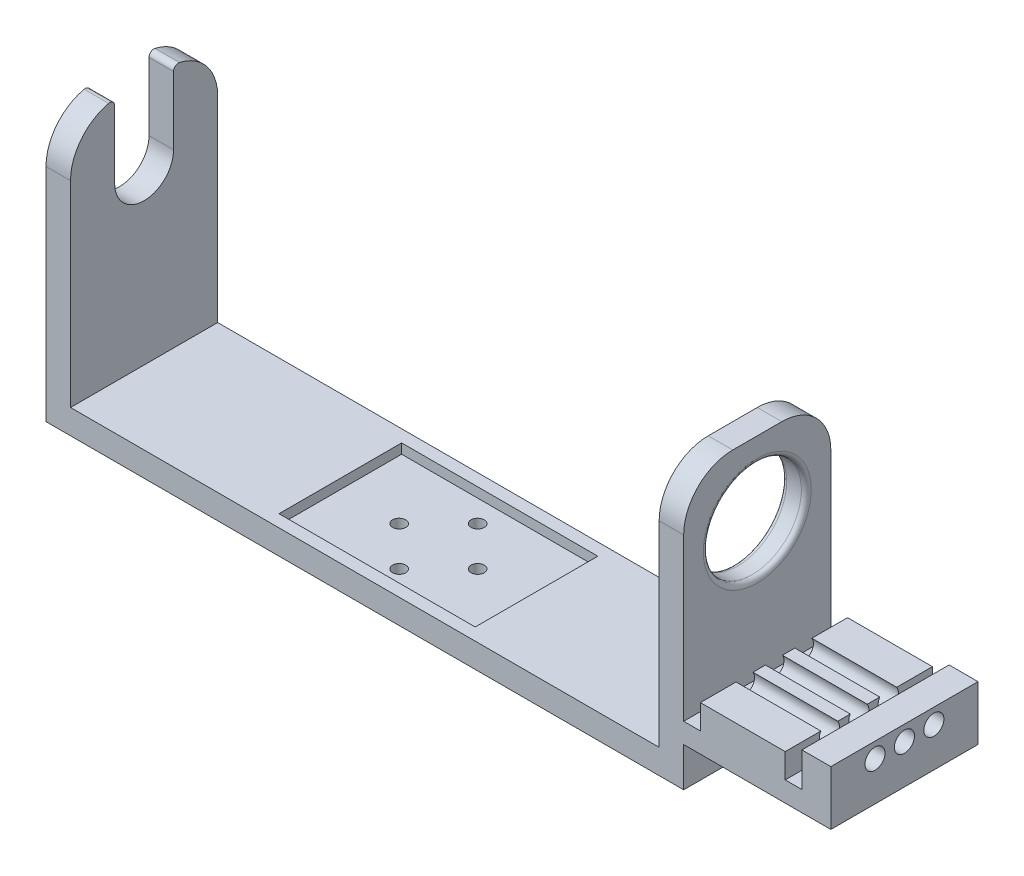
from build123d import *

# Parameters (mm, degrees)
SKETCH1_W           = 130
SKETCH1_H           = 30
BOSS_EXTRUDE1_DEPTH = 5
BOSS_EXTRUDE3_DEPTH = 1.8
SKETCH6_W           = 40
SKETCH6_H           = 25
CUT_EXTRUDE2_DEPTH  = 2
SKETCH5_R           = 1.35
CUT_EXTRUDE3_DEPTH  = 6
SKETCH8_W           = 5
SKETCH8_H           = 30
BOSS_EXTRUDE4_DEPTH = 50
SKETCH9_R           = 10
CUT_EXTRUDE4_DEPTH  = 5
SKETCH10_W          = 30
SKETCH10_H          = 11.1
BOSS_EXTRUDE5_DEPTH = 30
SKETCH11_W          = 3.4
SKETCH11_H          = 30
CUT_EXTRUDE5_DEPTH  = 7
CUT_EXTRUDE6_REACH  = 173.828
SKETCH12_R          = 2.05
CUT_EXTRUDE7_DEPTH  = 5
SKETCH14_W          = 17.3
SKETCH14_H          = 30
CUT_EXTRUDE8_DEPTH  = 2
FILLET1_R           = 10
FILLET3_R           = 1
FILLET6_R           = 1


with BuildPart() as part:
    # Sketch1 → Boss-Extrude1 (new body)
    with BuildSketch(Plane(origin=(0, 0, 0), x_dir=(1, 0, 0), z_dir=(0, 1, 0))):
        with Locations((65, -15)):
            Rectangle(SKETCH1_W, SKETCH1_H)
    extrude(amount=BOSS_EXTRUDE1_DEPTH)

    # Sketch4 → Boss-Extrude3 (add)
    with BuildSketch(Plane.XZ):
        Polygon((63.1, 25), (66.9, 25), (66.9, 17), (66.9, 16.95), (67.95, 16.95), (74.95, 16.95), (74.95, 13.15), (66.95, 13.15), (66.9, 13.15), (66.9, 12.1), (66.9, 5.1), (63.1, 5.1), (63.1, 13.1), (63.1, 13.15), (62.05, 13.15), (55.05, 13.15), (55.05, 16.95), (63.05, 16.95), (63.1, 16.95), (63.1, 18), align=None)
    extrude(amount=BOSS_EXTRUDE3_DEPTH)

    # Sketch6 → Cut-Extrude2 (cut)
    with BuildSketch(Plane(origin=(0, 5, 0), x_dir=(1, 0, 0), z_dir=(0, 1, 0))):
        with Locations((65, -15)):
            Rectangle(SKETCH6_W, SKETCH6_H)
    extrude(amount=-CUT_EXTRUDE2_DEPTH, mode=Mode.SUBTRACT)

    # Sketch5 → Cut-Extrude3 (cut)
    with BuildSketch(Plane.XZ.offset(1.8)):
        with Locations(Location((65, 23, 0), (0, 0, 270))):
            Circle(SKETCH5_R)
        with Locations(Location((73, 15, 0), (0, 0, 270))):
            Circle(SKETCH5_R)
        with Locations(Location((57, 15, 0), (0, 0, 270))):
            Circle(SKETCH5_R)
        with Locations(Location((65, 7, 0), (0, 0, 270))):
            Circle(SKETCH5_R)
    extrude(amount=-CUT_EXTRUDE3_DEPTH, mode=Mode.SUBTRACT)

    # Sketch8 → Boss-Extrude4 (add)
    with BuildSketch(Plane(origin=(0, 5, 0), x_dir=(1, 0, 0), z_dir=(0, 1, 0))):
        with Locations((2.5, -15)):
            Rectangle(SKETCH8_W, SKETCH8_H)
        with Locations((127.5, -15)):
            Rectangle(SKETCH8_W, SKETCH8_H)
    extrude(amount=BOSS_EXTRUDE4_DEPTH)

    # Sketch9 → Cut-Extrude4 (cut)
    with BuildSketch(Plane(origin=(130, 0, 0), x_dir=(0, 0, -1), z_dir=(1, 0, 0))):
        with Locations((-15, 40)):
            Circle(SKETCH9_R)
    extrude(amount=-CUT_EXTRUDE4_DEPTH, mode=Mode.SUBTRACT)

    # Sketch10 → Boss-Extrude5 (add)
    with BuildSketch(Plane(origin=(130, 0, 0), x_dir=(0, 0, -1), z_dir=(1, 0, 0))):
        with Locations((-15, 13.55)):
            Rectangle(SKETCH10_W, SKETCH10_H)
    extrude(amount=BOSS_EXTRUDE5_DEPTH)

    # Sketch11 → Cut-Extrude5 (cut)
    with BuildSketch(Plane(origin=(0, 19.1, 0), x_dir=(1, 0, 0), z_dir=(0, 1, 0))):
        with Locations((131.7, -15)):
            Rectangle(SKETCH11_W, SKETCH11_H)
        with Locations((152.4, -15)):
            Rectangle(SKETCH11_W, SKETCH11_H)
    extrude(amount=-CUT_EXTRUDE5_DEPTH, mode=Mode.SUBTRACT)

    # Cut-Extrude6: up to this face of the body (flat: up to its plane)
    cut_extrude6_end = Plane(part.part.faces().sort_by_distance((130, 12.623489255, 15))[0])
    # Sketch12 → Cut-Extrude6 (cut, up to the picked face)
    with BuildSketch(Plane(origin=(160, 0, 0), x_dir=(0, 0, -1), z_dir=(1, 0, 0)), mode=Mode.PRIVATE) as cut_extrude6_sk1:
        with Locations((-15, 16)):
            Circle(SKETCH12_R)
    cut_extrude6_tool1 = split(extrude(cut_extrude6_sk1.sketch, amount=-CUT_EXTRUDE6_REACH, mode=Mode.PRIVATE), bisect_by=cut_extrude6_end, keep=Keep.BOTH, mode=Mode.PRIVATE)
    # Sketch12 → Cut-Extrude6 (cut, up to the picked face)
    with BuildSketch(Plane(origin=(160, 0, 0), x_dir=(0, 0, -1), z_dir=(1, 0, 0)), mode=Mode.PRIVATE) as cut_extrude6_sk2:
        with Locations((-21, 16)):
            Circle(SKETCH12_R)
    cut_extrude6_tool2 = split(extrude(cut_extrude6_sk2.sketch, amount=-CUT_EXTRUDE6_REACH, mode=Mode.PRIVATE), bisect_by=cut_extrude6_end, keep=Keep.BOTH, mode=Mode.PRIVATE)
    # Sketch12 → Cut-Extrude6 (cut, up to the picked face)
    with BuildSketch(Plane(origin=(160, 0, 0), x_dir=(0, 0, -1), z_dir=(1, 0, 0)), mode=Mode.PRIVATE) as cut_extrude6_sk3:
        with Locations((-9, 16)):
            Circle(SKETCH12_R)
    cut_extrude6_tool3 = split(extrude(cut_extrude6_sk3.sketch, amount=-CUT_EXTRUDE6_REACH, mode=Mode.PRIVATE), bisect_by=cut_extrude6_end, keep=Keep.BOTH, mode=Mode.PRIVATE)
    add(cut_extrude6_tool1.solids().sort_by(Axis((160, 16, 15), (-1, 0, 0)))[0], mode=Mode.SUBTRACT)
    add(cut_extrude6_tool2.solids().sort_by(Axis((160, 16, 21), (-1, 0, 0)))[0], mode=Mode.SUBTRACT)
    add(cut_extrude6_tool3.solids().sort_by(Axis((160, 16, 9), (-1, 0, 0)))[0], mode=Mode.SUBTRACT)

    # Sketch13 → Cut-Extrude7 (cut)
    with BuildSketch(Plane.ZY):
        with BuildLine():
            Line((9, 40), (9, 55))
            Line((9, 55), (21, 55))
            Line((21, 55), (21, 40))
            ThreePointArc((21, 40), (15, 34), (9, 40))
        make_face()
    extrude(amount=-CUT_EXTRUDE7_DEPTH, mode=Mode.SUBTRACT)

    # Sketch14 → Cut-Extrude8 (cut)
    with BuildSketch(Plane(origin=(0, 19.1, 0), x_dir=(1, 0, 0), z_dir=(0, 1, 0))):
        with Locations((142.05, -15)):
            Rectangle(SKETCH14_W, SKETCH14_H)
    extrude(amount=-CUT_EXTRUDE8_DEPTH, mode=Mode.SUBTRACT)

    # Fillet1
    # the kernel refuses this fillet: 10 mm, written as the material it takes off along each edge
    with BuildSketch(Plane(origin=(-24.874685928, 55, 0), x_dir=(0, -1, 0), z_dir=(1, 0, 0)), Plane(origin=(29.874685928, 55, 30), x_dir=(0, -1, 0), z_dir=(-1, 0, 0))) as fillet1_piece_1:
        with BuildLine():
            CenterArc((9.949874371, -10), FILLET1_R, 90, 84.260829523)
            Line((0, -9), (-0.198997487, -8.98))
            ThreePointArc((-0.198997487, -8.98), (-0.2, -4.5), (-0.2, 0))
            Line((-0.2, 0), (0, 0.2))
            Line((0, 0.2), (9.949874371, 0.2))
            Line((9.949874371, 0.2), (9.949874371, 0))
        make_face()
    extrude(amount=54.749371855, mode=Mode.SUBTRACT)
    with BuildSketch(Plane(origin=(155, 55, 0), x_dir=(0, -1, 0), z_dir=(-1, 0, 0)), Plane(origin=(100, 55, 30), x_dir=(0, -1, 0), z_dir=(1, 0, 0))) as fillet1_piece_2:
        with BuildLine():
            CenterArc((FILLET1_R, FILLET1_R), FILLET1_R, 180, 90)
            Line((0, FILLET1_R), (-FILLET1_R * 0.02, FILLET1_R))
            Line((-FILLET1_R * 0.02, FILLET1_R), (-FILLET1_R * 0.02, -FILLET1_R * 0.02))
            Line((-FILLET1_R * 0.02, -FILLET1_R * 0.02), (FILLET1_R, -FILLET1_R * 0.02))
            Line((FILLET1_R, -FILLET1_R * 0.02), (FILLET1_R, 0))
        make_face()
    extrude(amount=55, mode=Mode.SUBTRACT)

    # Fillet3
    fillet3_edges = [part.edges().sort_by_distance(p)[0] for p in [
        (2.5, 55, 9),
        (2.5, 55, 21),
    ]]
    fillet(fillet3_edges, radius=FILLET3_R)

    # Fillet6
    fillet6_edges = [part.edges().sort_by_distance(p)[0] for p in [
        (130, 40, 25),
        (125, 40, 25),
    ]]
    fillet(fillet6_edges, radius=FILLET6_R)


solid = part.part
